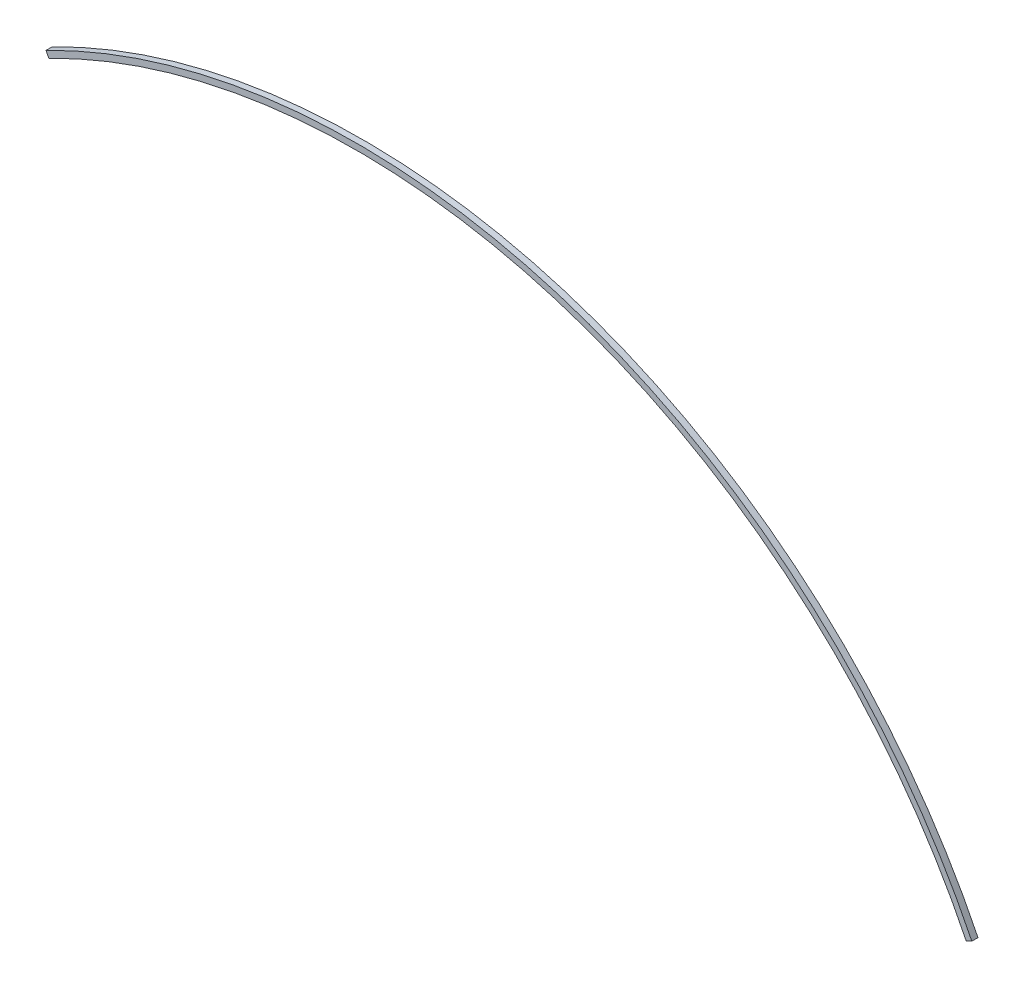
from build123d import *

# Parameters (mm, degrees)
SM_BASE_FLANGE_1_DEPTH = 5


# Sheet-metal steps are written as plain solids
with BuildPart() as part:
    # Sketch 1 → 基体-法兰1 (new, symmetric)
    with BuildSketch(Plane.XY):
        with BuildLine():
            ThreePointArc((-500, 1000), (354.84647099, 1064.539412971), (1000, 500))
            Line((1000, 500), (991.016660678, 495.606867334))
            ThreePointArc((991.016660678, 495.606867334), (351.68419333, 1055.052579991), (-495.449208142, 991.095490274))
            Line((-495.449208142, 991.095490274), (-500, 1000))
        make_face()
    extrude(amount=SM_BASE_FLANGE_1_DEPTH, both=True)


solid = part.part
